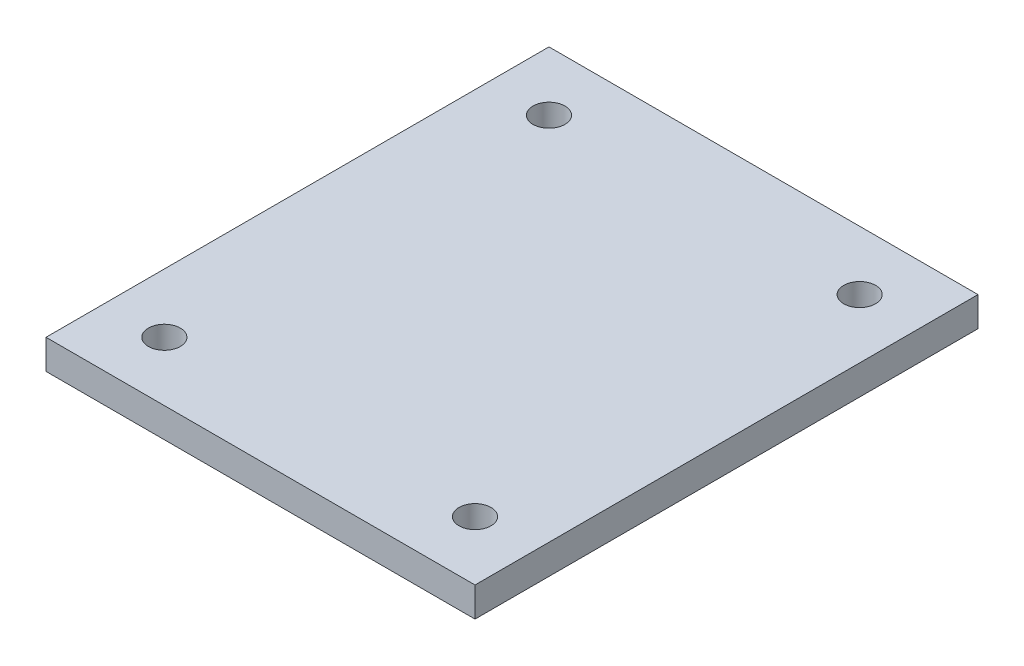
from build123d import *

# Parameters (mm, degrees)
SKETCH1_W           = 92.075
SKETCH1_H           = 107.95
BOSS_EXTRUDE1_DEPTH = 6.35
CUT_EXTRUDE2_REACH  = 73.226
SKETCH3_R           = 3.429


with BuildPart() as part:
    # Sketch1 → Boss-Extrude1 (new body)
    with BuildSketch(Plane(origin=(0, 0, 0), x_dir=(1, 0, 0), z_dir=(0, 1, 0))):
        Rectangle(SKETCH1_W, SKETCH1_H)
    extrude(amount=BOSS_EXTRUDE1_DEPTH)

    # Sketch3 → Cut-Extrude2 (cut, up to next)
    with BuildSketch(Plane.XZ, mode=Mode.PRIVATE) as cut_extrude2_sk1:
        with Locations((-33.3375, 41.275)):
            Circle(SKETCH3_R)
    cut_extrude2_tool1 = extrude(cut_extrude2_sk1.sketch, amount=-CUT_EXTRUDE2_REACH, mode=Mode.PRIVATE) & part.part
    # Sketch3 → Cut-Extrude2 (cut, up to next)
    with BuildSketch(Plane.XZ, mode=Mode.PRIVATE) as cut_extrude2_sk2:
        with Locations((-33.3375, -41.275)):
            Circle(SKETCH3_R)
    cut_extrude2_tool2 = extrude(cut_extrude2_sk2.sketch, amount=-CUT_EXTRUDE2_REACH, mode=Mode.PRIVATE) & part.part
    # Sketch3 → Cut-Extrude2 (cut, up to next)
    with BuildSketch(Plane.XZ, mode=Mode.PRIVATE) as cut_extrude2_sk3:
        with Locations((33.3375, 41.275)):
            Circle(SKETCH3_R)
    cut_extrude2_tool3 = extrude(cut_extrude2_sk3.sketch, amount=-CUT_EXTRUDE2_REACH, mode=Mode.PRIVATE) & part.part
    # Sketch3 → Cut-Extrude2 (cut, up to next)
    with BuildSketch(Plane.XZ, mode=Mode.PRIVATE) as cut_extrude2_sk4:
        with Locations((33.3375, -41.275)):
            Circle(SKETCH3_R)
    cut_extrude2_tool4 = extrude(cut_extrude2_sk4.sketch, amount=-CUT_EXTRUDE2_REACH, mode=Mode.PRIVATE) & part.part
    add(cut_extrude2_tool1.solids().sort_by_distance((-33.3375, 0, 41.275))[0], mode=Mode.SUBTRACT)
    add(cut_extrude2_tool2.solids().sort_by_distance((-33.3375, 0, -41.275))[0], mode=Mode.SUBTRACT)
    add(cut_extrude2_tool3.solids().sort_by_distance((33.3375, 0, 41.275))[0], mode=Mode.SUBTRACT)
    add(cut_extrude2_tool4.solids().sort_by_distance((33.3375, 0, -41.275))[0], mode=Mode.SUBTRACT)


solid = part.part
